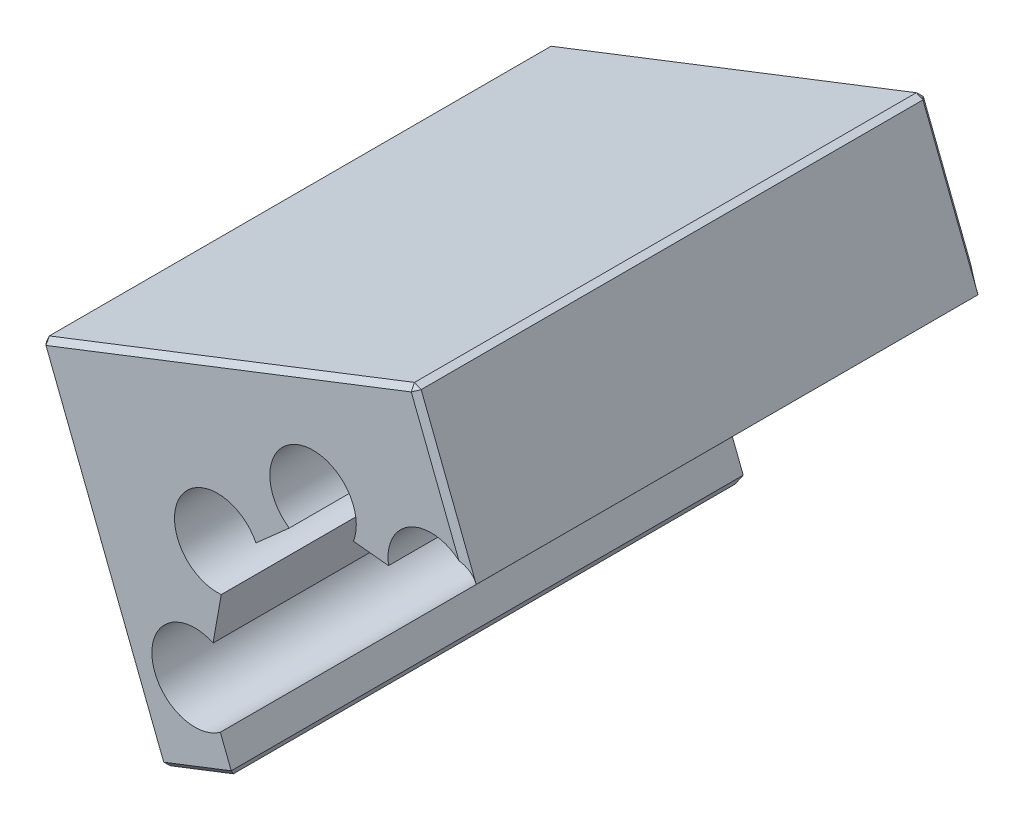
from build123d import *

# Parameters (mm, degrees)
EXTRUDE_2_DEPTH = 250
CHAMFER_1_SIZE  = 2.5


with BuildPart() as part:
    # 草圖1 → 填料-伸長2 (new body)
    with BuildSketch(Plane(origin=(1e-09, -1e-09, 12886.382690918), x_dir=(1, 0, 0), z_dir=(0, 0, 1))):
        with BuildLine():
            Line((-112.117770632, -75.640230505), (-108.139732902, -53.167558993))
            ThreePointArc((-108.139732902, -53.167558993), (-128.285417164, -21.997695969), (-91.181469021, -22.837926636))
            Line((-91.181469021, -22.837926636), (-74.915186503, -8.426224475))
            ThreePointArc((-74.915186503, -8.426224475), (-69.768626313, 29.297285814), (-43.57987489, 1.662170304))
            Line((-43.57987489, 1.662170304), (-26.446012397, -0.086903016))
            ThreePointArc((-26.446012397, -0.086903016), (-11.209248537, 23.49241234), (13.857582965, 10.851326786))
            Line((13.857582965, 10.851326786), (-13.929514572, 82.148324057))
            Line((-13.929514572, 82.148324057), (-196.933065463, 10.825018546))
            Line((-196.933065463, 10.825018546), (-137.638404215, -141.315063571))
            Line((-137.638404215, -141.315063571), (-102.351415407, -127.562408658))
            Line((-102.351415407, -127.562408658), (-108.57535624, -111.5928281))
            ThreePointArc((-108.57535624, -111.5928281), (-141.904281803, -96.725915639), (-112.117770632, -75.640230505))
        make_face()
    extrude(amount=-EXTRUDE_2_DEPTH)

    # 導角1
    chamfer_1_edges = [part.edges().sort_by_distance(p)[0] for p in [
        (-105.431290017, 46.4866713, 12636.382690918),
        (-0.035965803, 46.49982542, 12636.382690918),
        (-13.929514572, 82.148324055, 12761.382690918),
        (-167.285734839, -65.245022514, 12636.382690918),
        (-196.933065463, 10.825018545, 12761.382690918),
        (-102.351415406, -127.562408659, 12761.382690918),
        (-119.99490981, -134.438736116, 12636.382690918),
        (-137.638404215, -141.315063573, 12761.382690918),
        (-119.99490981, -134.438736116, 12886.382690918),
        (-167.285734839, -65.245022514, 12886.382690918),
        (-105.431290017, 46.4866713, 12886.382690918),
        (-0.035965803, 46.49982542, 12886.382690918),
    ]]
    chamfer(chamfer_1_edges, length=CHAMFER_1_SIZE)


solid = part.part
